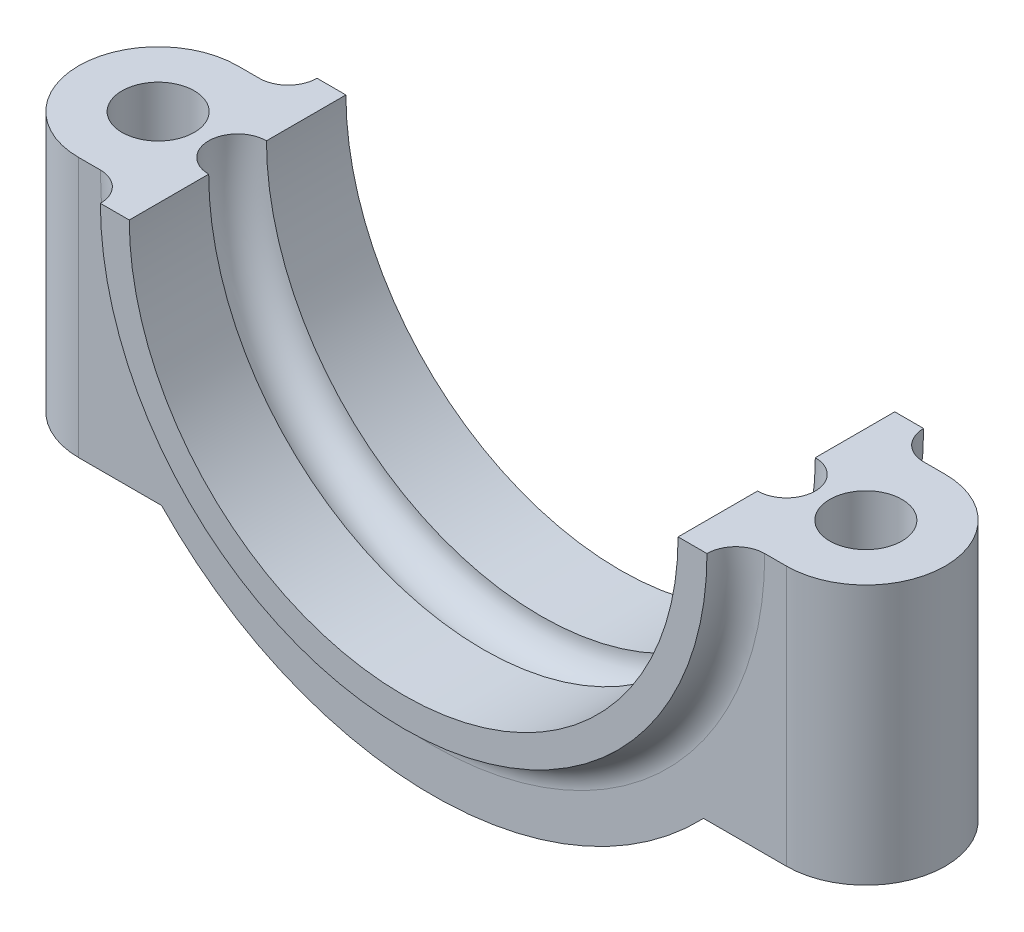
from build123d import *

# Parameters (mm, degrees)
BOSS_EXTRUDE1_DEPTH      = 5.5
BOSS_EXTRUDE2_DEPTH      = 2
BOSS_EXTRUDE2_DEPTH_BACK = 13
SKETCH3_R                = 2.5
CUT_EXTRUDE1_DEPTH       = 41.401113846
SKETCH4_R                = 2
FILLET1_R                = 2
FILLET2_RADIUS           = 5.5
FILLET2_LENGTH           = 18
FILLET3_RADIUS           = 5.5
FILLET3_LENGTH           = 18


with BuildPart() as part:
    # Sketch1 → Boss-Extrude1 (new, symmetric)
    with BuildSketch(Plane.XY):
        with BuildLine():
            Line((19, 0), (30, 0))
            Line((30, 0), (30, -18))
            Line((30, -18), (18.761663039, -18))
            ThreePointArc((18.761663039, -18), (0, -26), (-18.761663039, -18))
            Line((-18.761663039, -18), (-30, -18))
            Line((-30, -18), (-30, 0))
            Line((-30, 0), (-19, 0))
            ThreePointArc((-19, 0), (0, -19), (19, 0))
        make_face()
    extrude(amount=BOSS_EXTRUDE1_DEPTH, both=True)

    # Sketch2 → Boss-Extrude2 (add, two sides: drawn at the far end of the back side and taken through both)
    with BuildSketch(Plane.XY.offset(5.5).offset(-BOSS_EXTRUDE2_DEPTH_BACK)):
        with BuildLine():
            Line((-21, 0), (-19, 0))
            ThreePointArc((-19, 0), (0, -19), (19, 0))
            Line((19, 0), (21, 0))
            ThreePointArc((21, 0), (0, -21), (-21, 0))
        make_face()
    extrude(amount=BOSS_EXTRUDE2_DEPTH + BOSS_EXTRUDE2_DEPTH_BACK)

    # Sketch3 → Cut-Extrude1 (cut, through all)
    with BuildSketch(Plane(origin=(0, 0, 0), x_dir=(1, 0, 0), z_dir=(0, 1, 0))):
        with Locations(Location((24.5, 0, 0), (0, 0, 180))):
            Circle(SKETCH3_R)
        with Locations(Location((-24.5, 0, 0), (0, 0, 180))):
            Circle(SKETCH3_R)
    extrude(amount=-CUT_EXTRUDE1_DEPTH, mode=Mode.SUBTRACT)

    # Sketch4 → Cut-Revolve1 (revolve, cut)
    with BuildSketch(Plane(origin=(0, 0, 0), x_dir=(1, 0, 0), z_dir=(0, 1, 0))):
        with Locations((19, 0)):
            Circle(SKETCH4_R)
    revolve(axis=Axis((0, 0, 0), (0, 0, -1)), mode=Mode.SUBTRACT)

    # Fillet1
    fillet1_edges = [part.edges().sort_by_distance(p)[0] for p in [
        (0, -21, -5.5),
        (0, -21, 5.5),
    ]]
    fillet(fillet1_edges, radius=FILLET1_R - 0.0001)  # a hair under: the kernel refuses the full size

    # Fillet2: full round fillet: the end face becomes a half cylinder, R = half its width
    fillet2_face = Plane((-30, -9, 0), x_dir=(0, -1, 0), z_dir=(-1, 0, 0))  # on the end face: x along it, z out of the body
    fillet2_slab = fillet2_face.offset(-FILLET2_RADIUS / 2) * Box(FILLET2_LENGTH, 2 * FILLET2_RADIUS, FILLET2_RADIUS, mode=Mode.PRIVATE)  # the body's end, R deep
    fillet2_round = Plane((-24.5, -9, 0), x_dir=(-1, 0, 0), z_dir=(0, -1, 0)) * Cylinder(FILLET2_RADIUS, FILLET2_LENGTH, mode=Mode.PRIVATE)  # its axis R under the face
    add(fillet2_slab - fillet2_round, mode=Mode.SUBTRACT)

    # Fillet3: full round fillet: the end face becomes a half cylinder, R = half its width
    fillet3_face = Plane((30, -9, 0), x_dir=(0, -1, 0), z_dir=(1, 0, 0))  # on the end face: x along it, z out of the body
    fillet3_slab = fillet3_face.offset(-FILLET3_RADIUS / 2) * Box(FILLET3_LENGTH, 2 * FILLET3_RADIUS, FILLET3_RADIUS, mode=Mode.PRIVATE)  # the body's end, R deep
    fillet3_round = Plane((24.5, -9, 0), x_dir=(1, 0, 0), z_dir=(0, -1, 0)) * Cylinder(FILLET3_RADIUS, FILLET3_LENGTH, mode=Mode.PRIVATE)  # its axis R under the face
    add(fillet3_slab - fillet3_round, mode=Mode.SUBTRACT)


solid = part.part
